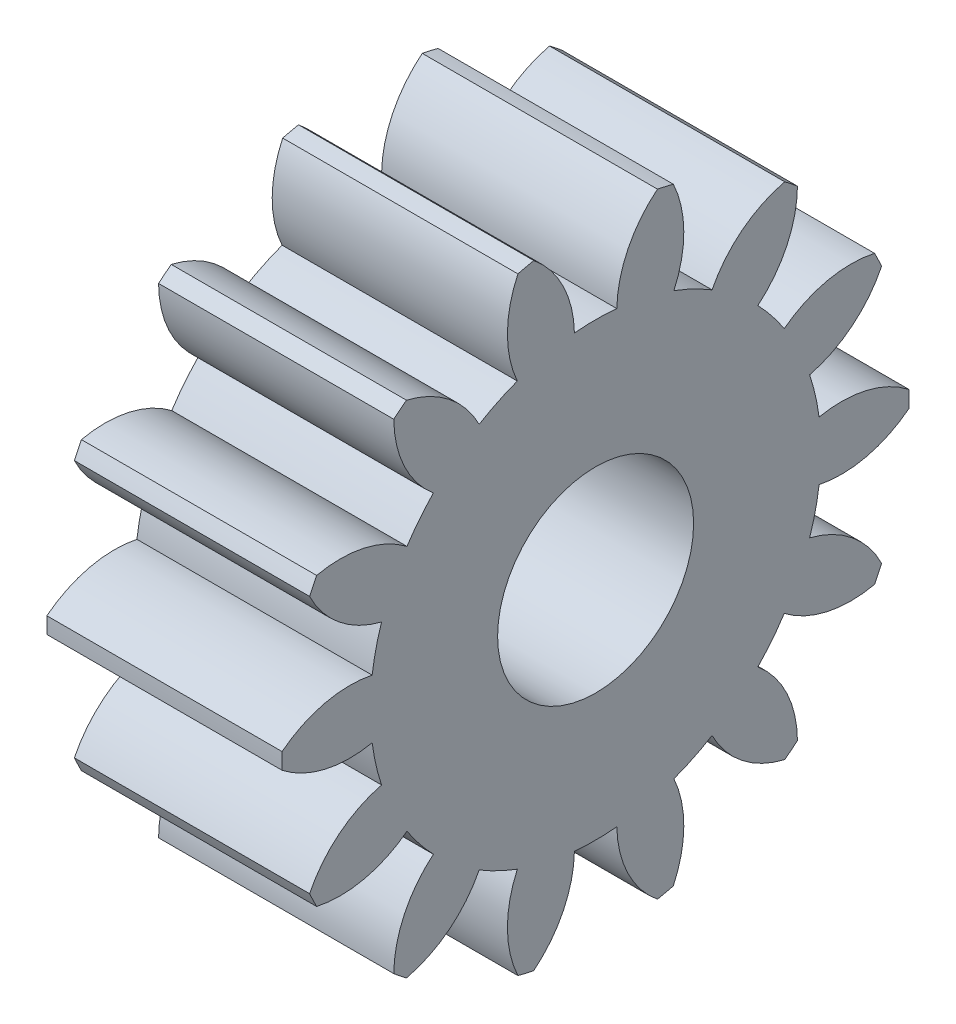
from build123d import *

# Parameters (mm, degrees)
BASPROSKE_W     = 6
BASPROSKE_H     = 8
TOOTHCUT_DEPTH  = 13.806248475
TEETHCUTS_COUNT = 14
TEETHCUTS_ANGLE = 334.285714286
BORSKE_R        = 2.5
BORE_DEPTH      = 10.0000508


with BuildPart() as part:
    # BasProSke → Base-Revolve (revolve)
    with BuildSketch(Plane(origin=(0, 0, 0), x_dir=(1, 0, 0), z_dir=(0, 1, 0))):
        with Locations((3, 4)):
            Rectangle(BASPROSKE_W, BASPROSKE_H)
    revolve(axis=Axis((-10, 0, 0), (1, 0, 0)))

    # TooCutSke → ToothCut (cut, through all)
    with BuildSketch(Plane(origin=(0, 0, 0), x_dir=(0, 0, -1), z_dir=(1, 0, 0))):
        with BuildLine():
            ThreePointArc((0.540393256, 5.723545765), (0, 5.749), (-0.540393256, 5.723545765))
            ThreePointArc((-0.540393256, 5.723545765), (-0.832220085, 6.912663993), (-1.603550271, 7.863566092))
            ThreePointArc((-1.603550271, 7.863566092), (0, 8.0254), (1.603550271, 7.863566092))
            ThreePointArc((1.603550271, 7.863566092), (0.832220085, 6.912663993), (0.540393256, 5.723545765))
        make_face()
    toothcut = extrude(amount=TOOTHCUT_DEPTH, mode=Mode.SUBTRACT)

    # TeethCuts: ToothCut ×14 about axis
    teethcuts_axis = Axis((-10, 0, 0), (1, 0, 0))
    for i in range(1, TEETHCUTS_COUNT):
        add(toothcut.rotate(teethcuts_axis, i * TEETHCUTS_ANGLE / (TEETHCUTS_COUNT - 1)), mode=Mode.SUBTRACT)

    # BorSke → Bore (cut, symmetric)
    with BuildSketch(Plane(origin=(0, 0, 0), x_dir=(0, 0, -1), z_dir=(1, 0, 0))):
        Circle(BORSKE_R)
    extrude(amount=BORE_DEPTH, both=True, mode=Mode.SUBTRACT)


solid = part.part
